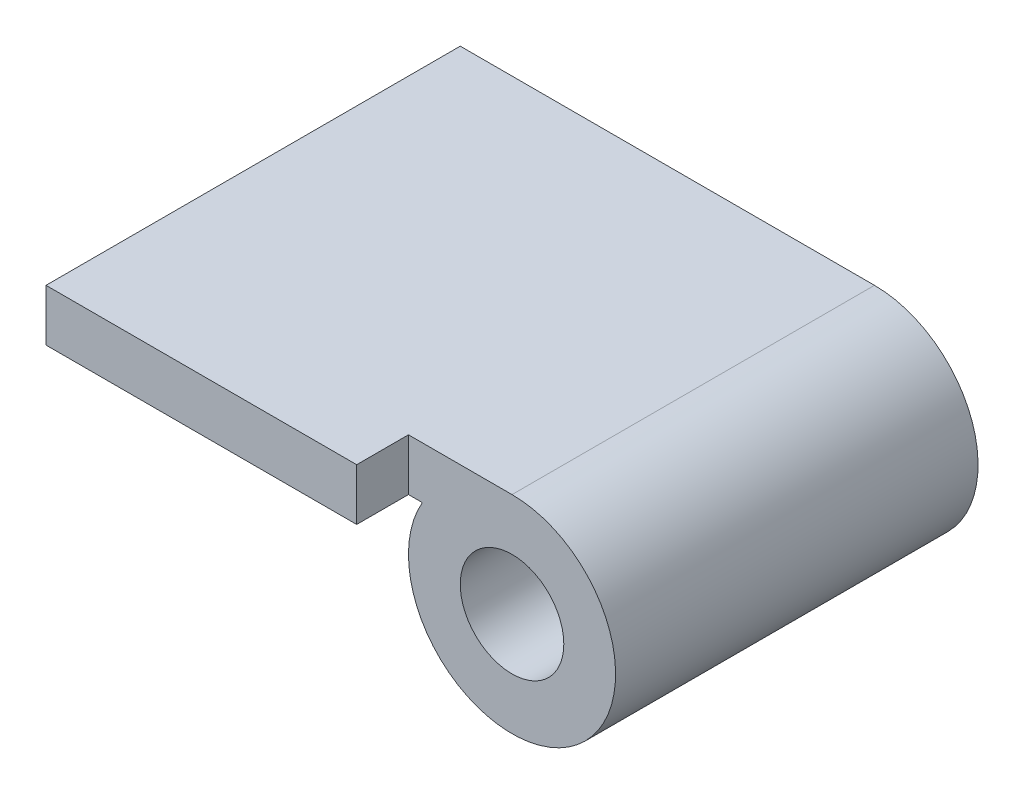
from build123d import *

# Parameters (mm, degrees)
SKETCH1_R           = 3.175
BOSS_EXTRUDE1_DEPTH = 25.4
SKETCH2_W           = 12.7
SKETCH2_H           = 12.7
CUT_EXTRUDE1_DEPTH  = 3.175


with BuildPart() as part:
    # Sketch1 → Boss-Extrude1 (new body)
    with BuildSketch(Plane.XY):
        with BuildLine():
            Line((0, 6.35), (-25.4, 6.35))
            Line((-25.4, 6.35), (-25.4, 3.175))
            Line((-25.4, 3.175), (-5.499261314, 3.175))
            ThreePointArc((-5.499261314, 3.175), (3.175, -5.499261314), (0, 6.35))
        make_face()
        Circle(SKETCH1_R, mode=Mode.SUBTRACT)
    extrude(amount=BOSS_EXTRUDE1_DEPTH)

    # Sketch2 → Cut-Extrude1 (cut)
    with BuildSketch(Plane.XY.offset(25.4)):
        Rectangle(SKETCH2_W, SKETCH2_H)
    extrude(amount=-CUT_EXTRUDE1_DEPTH, mode=Mode.SUBTRACT)


solid = part.part
